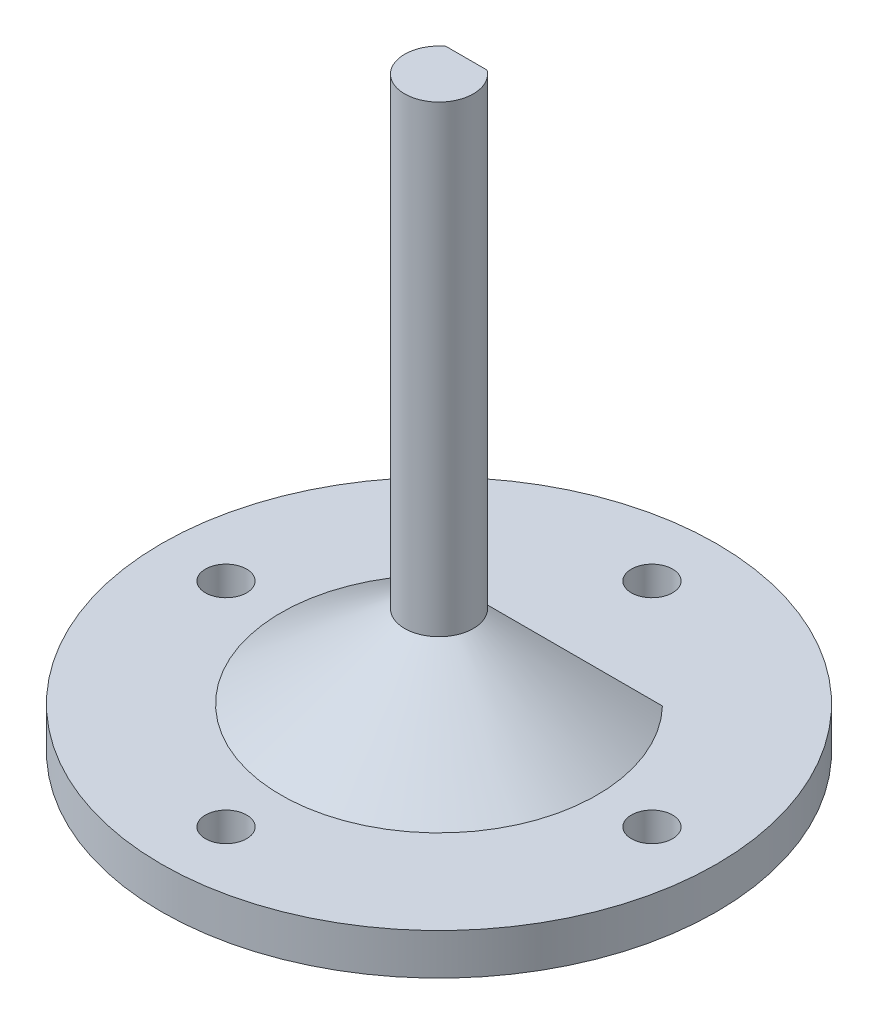
from build123d import *

# Parameters (mm, degrees)
SKETCH2_R           = 20.203446649
SKETCH2_R_2         = 1.5
BOSS_EXTRUDE1_DEPTH = 3
BOSS_EXTRUDE2_DEPTH = 39.7
CHAMFER1_SIZE       = 9
CHAMFER1_SIZE2      = 6
CHAMFER2_SIZE       = 6


with BuildPart() as part:
    # Sketch2 → Boss-Extrude1 (new body)
    with BuildSketch(Plane(origin=(0, 0, 0), x_dir=(1, 0, 0), z_dir=(0, 1, 0))):
        Circle(SKETCH2_R)
        with Locations((0, -15.5)):
            Circle(SKETCH2_R_2, mode=Mode.SUBTRACT)
        with Locations((-15.5, 0)):
            Circle(SKETCH2_R_2, mode=Mode.SUBTRACT)
        with Locations((0, 15.5)):
            Circle(SKETCH2_R_2, mode=Mode.SUBTRACT)
        with Locations((15.5, 0)):
            Circle(SKETCH2_R_2, mode=Mode.SUBTRACT)
    extrude(amount=-BOSS_EXTRUDE1_DEPTH)

    # Sketch2<3> → Boss-Extrude2 (add)
    with BuildSketch(Plane(origin=(0, 0, 0), x_dir=(1, 0, 0), z_dir=(0, 1, 0))):
        with BuildLine():
            Line((1.5, 2), (-1.5, 2))
            ThreePointArc((-1.5, 2), (-1.118033989, -2.236067977), (2.5, 0))
            ThreePointArc((2.5, 0), (2.236067977, 1.118033989), (1.5, 2))
        make_face()
    extrude(amount=BOSS_EXTRUDE2_DEPTH)

    # Chamfer1
    chamfer1_edges = [part.edges().sort_by_distance(p)[0] for p in [
        (-1.118033989, 0, 2.236067977),
    ]]
    chamfer1_side = [part.faces().sort_by_distance(p)[0] for p in [
        (-19.632006884, 0, 0),
    ]]
    chamfer(chamfer1_edges, length=CHAMFER1_SIZE, length2=CHAMFER1_SIZE2, reference=chamfer1_side[0])

    # Chamfer2
    chamfer2_edges = [part.edges().sort_by_distance(p)[0] for p in [
        (0, 0, -2),
    ]]
    chamfer(chamfer2_edges, length=CHAMFER2_SIZE)


solid = part.part
